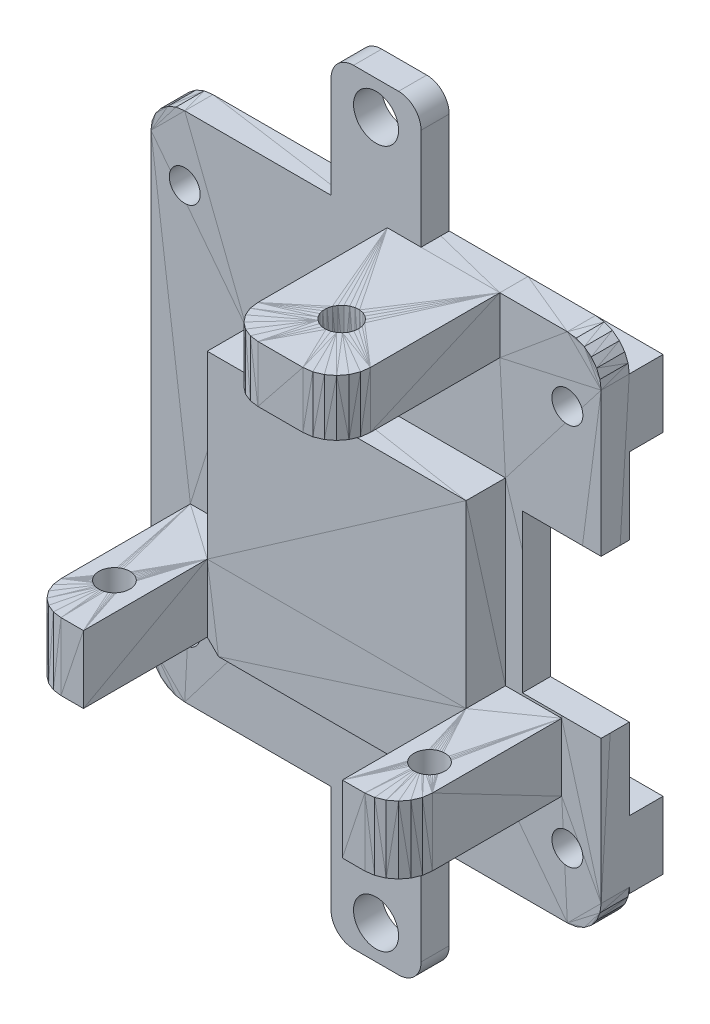
from build123d import *
from build123d.topology import SkipClean

# Parameters (mm, degrees)
CUT_EXTRUDE1_START       = 9.499999695
CUT_EXTRUDE1_DEPTH       = 22.000000812
CUT_EXTRUDE1_START_2     = 7.124999176
CUT_EXTRUDE1_2_OUTLINE_W = 39.999999106
CUT_EXTRUDE1_2_OUTLINE_H = 2.499999944
CUT_EXTRUDE1_2_DEPTH     = 31.2499998
CUT_EXTRUDE1_3_DEPTH     = 6.000000052
CUT_EXTRUDE1_START_3     = 40.500000119
CUT_EXTRUDE1_4_DEPTH     = 4.999998957
CUT_EXTRUDE1_START_4     = 41.124999176
CUT_EXTRUDE1_5_OUTLINE_W = 39.999999106
CUT_EXTRUDE1_5_OUTLINE_H = 2.499999944
CUT_EXTRUDE1_5_DEPTH     = 2.151459803
CUT_EXTRUDE1_START_5     = 2.223542891
CUT_EXTRUDE1_6_OUTLINE_W = 39.999999106
CUT_EXTRUDE1_6_OUTLINE_H = 2.499999944
CUT_EXTRUDE1_6_DEPTH     = 2.151456085
CUT_EXTRUDE1_7_DEPTH     = 2.499999944
CUT_EXTRUDE1_8_DEPTH     = 2.499999944
CUT_EXTRUDE1_START_6     = 2.499999944
CUT_EXTRUDE1_9_DEPTH     = 3.500000108
CUT_EXTRUDE2_REACH       = 64.923
SKETCH2_W                = 7
SKETCH2_H                = 14
SKETCH3_W                = 6
SKETCH3_H                = 6
BOSS_EXTRUDE1_DEPTH      = 3
CUT_EXTRUDE3_START       = -3
SKETCH4_R                = 1.375
CUT_EXTRUDE3_DEPTH       = 3
BOSS_EXTRUDE2_DEPTH      = 11.5
BOSS_EXTRUDE2_DEPTH_BACK = 56.5
SKETCH5_W                = 8
SKETCH5_H                = 2.499999944
CUT_EXTRUDE4_REACH       = 73.283
SKETCH6_R                = 2
FILLET1_R                = 2
SKETCH7_R                = 1.375
CUT_EXTRUDE5_DEPTH       = 10
SKETCH8_W                = 6
SKETCH8_H                = 1.5
CUT_EXTRUDE6_DEPTH       = 2


with BuildPart() as part:
    # Cut-Extrude1: read off the stored shape, not the designer's step
    # Cut-Extrude1 outline → Cut-Extrude1 (new body)
    with BuildSketch(Plane(origin=(0, 0, 0), x_dir=(1, 0, 0), z_dir=(0, 1, 0)).offset(CUT_EXTRUDE1_START)):
        Polygon((8.500000462, -2.499999944), (8.500000462, -6.000000052), (31.500000507, -6.000000052), (31.500000507, -2.499999944), (39.999999106, -2.499999944), (39.999999106, 0), (0, 0), (0, -2.499999944), align=None)
    extrude(amount=CUT_EXTRUDE1_DEPTH)

    # Cut-Extrude1 2 outline → Cut-Extrude1 2 (add)
    with BuildSketch(Plane(origin=(0, 0, 0), x_dir=(1, 0, 0), z_dir=(0, 1, 0)).offset(CUT_EXTRUDE1_START_2)):
        with Locations((19.999999553, -1.249999972)):
            Rectangle(CUT_EXTRUDE1_2_OUTLINE_W, CUT_EXTRUDE1_2_OUTLINE_H)
    extrude(amount=CUT_EXTRUDE1_2_DEPTH)

    # Cut-Extrude1 3 outline → Cut-Extrude1 3 (add)
    # profile 1 of 2: a face of its own
    with BuildSketch(Plane(origin=(0, 0, 0), x_dir=(1, 0, 0), z_dir=(0, 1, 0)).offset(CUT_EXTRUDE1_START)):
        Polygon((8.500000462, -2.499999944), (3.500000108, -2.499999944), (3.500000108, -14.000000432), (3.602222539, -14.776457101), (3.901924007, -15.499999747), (4.378679674, -16.121320426), (4.999999888, -16.598075628), (5.723542534, -16.897777095), (6.500000134, -17.000000924), (8.500000462, -17.000000924), align=None)
        Polygon((6.231762934, -12.463292107), (6.047092844, -12.498520315), (5.859463941, -12.48671487), (5.680665374, -12.428619899), (5.521932151, -12.327884324), (5.393237341, -12.190839276), (5.302667618, -12.0260939), (5.255914293, -11.843999848), (5.255914293, -11.656000279), (5.302667618, -11.473906226), (5.393237341, -11.309160851), (5.521932151, -11.172114871), (5.680665374, -11.071379296), (5.859463941, -11.013284326), (6.047092844, -11.001479812), (6.231762934, -11.03670802), (6.4018704, -11.116754264), (6.546726916, -11.236589402), (6.657229736, -11.388684623), (6.726437714, -11.563482694), (6.750000175, -11.749999598), (6.726437714, -11.936517432), (6.657229736, -12.111315504), (6.546726916, -12.263410725), (6.4018704, -12.383245863), align=None, mode=Mode.SUBTRACT)
    # profile 2 of 2: a face of its own
    with BuildSketch(Plane(origin=(0, 0, 0), x_dir=(1, 0, 0), z_dir=(0, 1, 0)).offset(CUT_EXTRUDE1_START)):
        Polygon((36.499999464, -2.499999944), (31.500000507, -2.499999944), (31.500000507, -17.000000924), (33.500000834, -17.000000924), (34.276459366, -16.897777095), (35.000000149, -16.598075628), (35.621318966, -16.121320426), (36.098074168, -15.499999747), (36.397777498, -14.776457101), (36.499999464, -14.000000432), align=None)
        Polygon((33.859461546, -12.48671487), (33.680662513, -12.428619899), (33.521931618, -12.327884324), (33.39323774, -12.190839276), (33.302668482, -12.0260939), (33.255912364, -11.843999848), (33.255912364, -11.656000279), (33.302668482, -11.473906226), (33.39323774, -11.309160851), (33.521931618, -11.172114871), (33.680662513, -11.071379296), (33.859461546, -11.013284326), (34.047093242, -11.001479812), (34.231763333, -11.03670802), (34.401871264, -11.116754264), (34.546725452, -11.236589402), (34.657228738, -11.388684623), (34.726437181, -11.563482694), (34.749999642, -11.749999598), (34.726437181, -11.936517432), (34.657228738, -12.111315504), (34.546725452, -12.263410725), (34.401871264, -12.383245863), (34.231763333, -12.463292107), (34.047093242, -12.498520315), align=None, mode=Mode.SUBTRACT)
    extrude(amount=CUT_EXTRUDE1_3_DEPTH)



with BuildPart() as body_2:
    # Cut-Extrude1 4 outline → Cut-Extrude1 4 (new body)
    with BuildSketch(Plane(origin=(0, 0, 0), x_dir=(1, 0, 0), z_dir=(0, 1, 0)).offset(CUT_EXTRUDE1_START_3)):
        Polygon((20.999999717, -2.499999944), (20.999999717, -14.000000432), (21.102221683, -14.776457101), (21.401925012, -15.499999747), (21.878678352, -16.121320426), (22.500000894, -16.598075628), (23.22354354, -16.897777095), (24.000000209, -17.000000924), (28.000000864, -17.000000924), (28.776457533, -16.897777095), (29.500000179, -16.598075628), (30.121320859, -16.121320426), (30.59807606, -15.499999747), (30.897777528, -14.776457101), (30.999999493, -14.000000432), (30.999999493, -2.499999944), align=None)
        Polygon((25.718927383, -13.023430482), (25.36133118, -12.90724054), (25.043863803, -12.70576939), (24.786474183, -12.431677431), (24.605335668, -12.102187611), (24.511827156, -11.737999506), (24.511827156, -11.362000369), (24.605335668, -10.997813195), (24.786474183, -10.668322444), (25.043863803, -10.394229554), (25.36133118, -10.192759335), (25.718927383, -10.076569393), (26.094185188, -10.052959435), (26.46352537, -10.123414919), (26.803739369, -10.283508338), (27.093453333, -10.523178615), (27.314459905, -10.827369988), (27.452874929, -11.176965199), (27.499999851, -11.549999937), (27.452874929, -11.923034675), (27.314459905, -12.272630818), (27.093453333, -12.576820329), (26.803739369, -12.816492468), (26.46352537, -12.976584025), (26.094185188, -13.04704044), align=None, mode=Mode.SUBTRACT)
    extrude(amount=CUT_EXTRUDE1_4_DEPTH)

    # Cut-Extrude1 5 outline → Cut-Extrude1 5 (add)
    with BuildSketch(Plane(origin=(0, 0, 0), x_dir=(1, 0, 0), z_dir=(0, 1, 0)).offset(CUT_EXTRUDE1_START_4)):
        with Locations((19.999999553, -1.249999972)):
            Rectangle(CUT_EXTRUDE1_5_OUTLINE_W, CUT_EXTRUDE1_5_OUTLINE_H)
    extrude(amount=CUT_EXTRUDE1_5_DEPTH)


with BuildPart() as body_3:
    # Cut-Extrude1 6 outline → Cut-Extrude1 6 (new body)
    with BuildSketch(Plane(origin=(0, 0, 0), x_dir=(1, 0, 0), z_dir=(0, 1, 0)).offset(CUT_EXTRUDE1_START_5)):
        with Locations((19.999999553, -1.249999972)):
            Rectangle(CUT_EXTRUDE1_6_OUTLINE_W, CUT_EXTRUDE1_6_OUTLINE_H)
    extrude(amount=CUT_EXTRUDE1_6_DEPTH)


with BuildPart() as cut_extrude1_7_tool:
    # Cut-Extrude1 7 outline → Cut-Extrude1 7 (new body)
    with BuildSketch(Plane.XY):
        Polygon((0, 42.500000447), (0.102222526, 43.276458979), (0, 43.276458979), align=None)
        Polygon((39.999999106, 43.276458979), (39.89777714, 43.276458979), (39.999999106, 42.500000447), align=None)
        Polygon((0.102222526, 2.223542891), (0, 3.000000026), (0, 2.223542891), align=None)
        Polygon((39.999999106, 2.223542891), (39.999999106, 3.000000026), (39.89777714, 2.223542891), align=None)
    extrude(amount=CUT_EXTRUDE1_7_DEPTH)


with BuildPart() as body_2_1:
    add(body_2.part)

    # Cut-Extrude1 7: cut by cut_extrude1_7_tool
    add(cut_extrude1_7_tool.part, mode=Mode.SUBTRACT)


with BuildPart() as body_3_1:
    add(body_3.part)

    # Cut-Extrude1 7: cut by cut_extrude1_7_tool
    add(cut_extrude1_7_tool.part, mode=Mode.SUBTRACT)


with BuildPart() as part_1:
    add(part.part)

    add(body_2_1.part)  # Cut-Extrude1 8 merges body 2

    add(body_3_1.part)  # Cut-Extrude1 8 merges body 3
    # Cut-Extrude1 8 outline → Cut-Extrude1 8 (add)
    with BuildSketch(Plane.XY):
        Polygon((1.500000013, 45.098077506), (0.878679624, 44.621318579), (0.401923782, 43.999999762), (0.102222526, 43.276458979), (39.89777714, 43.276458979), (39.598077536, 43.999999762), (39.121318609, 44.621318579), (38.499999791, 45.098077506), (37.776459008, 45.39777711), (37.000000477, 45.499999076), (3.000000026, 45.499999076), (2.223542891, 45.39777711), align=None)
        with BuildLine():
            Line((3.000000072, 41.124999076), (0, 41.124999176))
            Line((0, 41.124999176), (0, 38.374998976))
            Line((0, 38.374998976), (2.999999904, 38.374999076))
            ThreePointArc((2.999999904, 38.374999076), (1.625, 39.74999916), (3.000000072, 41.124999076))
        make_face()
        with BuildLine():
            Line((37, 41.124999076), (3.000000072, 41.124999076))
            ThreePointArc((3.000000072, 41.124999076), (4.375, 39.749998992), (2.999999904, 38.374999076))
            Line((2.999999904, 38.374999076), (37, 38.374999076))
            ThreePointArc((37, 38.374999076), (35.625, 39.749999076), (37, 41.124999076))
        make_face()
        with BuildLine():
            Line((39.999999106, 38.374998976), (39.999999106, 41.124999176))
            Line((39.999999106, 41.124999176), (37, 41.124999076))
            ThreePointArc((37, 41.124999076), (38.375, 39.749999076), (37, 38.374999076))
            Line((37, 38.374999076), (39.999999106, 38.374998976))
        make_face()
        with BuildLine():
            Line((3.000000032, 7.124999076), (0, 7.124999176))
            Line((0, 7.124999176), (0, 4.374998976))
            Line((0, 4.374998976), (2.999999968, 4.374999076))
            ThreePointArc((2.999999968, 4.374999076), (1.625, 5.749999108), (3.000000032, 7.124999076))
        make_face()
        with BuildLine():
            Line((37, 7.124999076), (3.000000032, 7.124999076))
            ThreePointArc((3.000000032, 7.124999076), (4.375, 5.749999044), (2.999999968, 4.374999076))
            Line((2.999999968, 4.374999076), (37, 4.374999076))
            ThreePointArc((37, 4.374999076), (35.625, 5.749999076), (37, 7.124999076))
        make_face()
        with BuildLine():
            Line((39.999999106, 4.374998976), (39.999999106, 7.124999176))
            Line((39.999999106, 7.124999176), (37, 7.124999076))
            ThreePointArc((37, 7.124999076), (38.375, 5.749999076), (37, 4.374999076))
            Line((37, 4.374999076), (39.999999106, 4.374998976))
        make_face()
        Polygon((39.89777714, 2.223542891), (0.102222526, 2.223542891), (0.401923782, 1.500000013), (0.878679624, 0.878679624), (1.500000013, 0.401923782), (2.223542891, 0.102222526), (3.000000026, 0), (37.000000477, 0), (37.776459008, 0.102222526), (38.499999791, 0.401923782), (39.121318609, 0.878679624), (39.598077536, 1.500000013), align=None)
    extrude(amount=CUT_EXTRUDE1_8_DEPTH)

    # Cut-Extrude1 9 outline → Cut-Extrude1 9 (add)
    with BuildSketch(Plane.XY.offset(CUT_EXTRUDE1_START_6)):
        Polygon((31.500000507, 9.499999695), (8.500000462, 9.499999695), (9.499999695, 8.500000462), (30.500000343, 8.500000462), align=None)
    extrude(amount=CUT_EXTRUDE1_9_DEPTH)

    # Cut-Extrude2: up to this face of the body (flat: up to its plane)
    cut_extrude2_end = Plane(part_1.part.faces().sort_by_distance((0.651754208, 2.690847606, 2.499999944))[0])
    # Sketch2 → Cut-Extrude2 (cut, up to the picked face)
    with BuildSketch(Plane(origin=(0, 0, 0), x_dir=(-1, 0, 0), z_dir=(0, 0, -1)), mode=Mode.PRIVATE) as cut_extrude2_sk1:
        with Locations((-36.499999106, 22.7092172)):
            Rectangle(SKETCH2_W, SKETCH2_H)
    cut_extrude2_tool1 = split(extrude(cut_extrude2_sk1.sketch, amount=-CUT_EXTRUDE2_REACH, mode=Mode.PRIVATE), bisect_by=cut_extrude2_end, keep=Keep.BOTH, mode=Mode.PRIVATE)
    add(cut_extrude2_tool1.solids().sort_by(Axis((36.499999, 22.709217, 0), (0, 0, 1)))[0], mode=Mode.SUBTRACT)

    # Sketch3 → Boss-Extrude1 (add)
    with BuildSketch(Plane(origin=(0, 0, 0), x_dir=(-1, 0, 0), z_dir=(0, 0, -1))):
        with Locations((-37, 39.500000447)):
            Rectangle(SKETCH3_W, SKETCH3_H)
        with Locations((-3, 39.500000447)):
            Rectangle(SKETCH3_W, SKETCH3_H)
        with Locations((-37, 5.500000447)):
            Rectangle(SKETCH3_W, SKETCH3_H)
        with Locations((-3, 5.500000447)):
            Rectangle(SKETCH3_W, SKETCH3_H)
    extrude(amount=BOSS_EXTRUDE1_DEPTH)

    # Sketch4 → Cut-Extrude3 (cut)
    with SkipClean():  # the faces are left unmerged after this step: merging them gives an invalid solid
        with BuildSketch(Plane.XY.offset(CUT_EXTRUDE3_START)):
            with Locations(Location((37, 5.749999076, 0), (0, 0, 105.709583928))):
                Circle(SKETCH4_R)
            with Locations(Location((3, 5.749999076, 0), (0, 0, 165.086240986))):
                Circle(SKETCH4_R)
            with Locations(Location((3, 39.749999076, 0), (0, 0, 157.929009931))):
                Circle(SKETCH4_R)
            with Locations(Location((37, 39.749999076, 0), (0, 0, 262.540518145))):
                Circle(SKETCH4_R)
        extrude(amount=CUT_EXTRUDE3_DEPTH, mode=Mode.SUBTRACT)

    # Sketch5 → Boss-Extrude2 (add, two sides: drawn at the far end of the back side and taken through both)
    with SkipClean():  # the faces are left unmerged after this step: merging them gives an invalid solid
        with BuildSketch(Plane(origin=(0, 0, 0), x_dir=(-1, 0, 0), z_dir=(0, -1, 0)).offset(-BOSS_EXTRUDE2_DEPTH_BACK)):
            with Locations((-20.000000251, -1.249999972)):
                Rectangle(SKETCH5_W, SKETCH5_H)
        extrude(amount=BOSS_EXTRUDE2_DEPTH + BOSS_EXTRUDE2_DEPTH_BACK)

    # Sketch6 → Cut-Extrude4 (cut, up to next)
    with BuildSketch(Plane(origin=(0, 0, 0), x_dir=(-1, 0, 0), z_dir=(0, 0, -1)), mode=Mode.PRIVATE) as cut_extrude4_sk1:
        with Locations((-20.000000251, 53.5)):
            Circle(SKETCH6_R)
    cut_extrude4_tool1 = extrude(cut_extrude4_sk1.sketch, amount=-CUT_EXTRUDE4_REACH, mode=Mode.PRIVATE) & part_1.part
    # Sketch6 → Cut-Extrude4 (cut, up to next)
    with BuildSketch(Plane(origin=(0, 0, 0), x_dir=(-1, 0, 0), z_dir=(0, 0, -1)), mode=Mode.PRIVATE) as cut_extrude4_sk2:
        with Locations((-20.000000251, -8.5)):
            Circle(SKETCH6_R)
    cut_extrude4_tool2 = extrude(cut_extrude4_sk2.sketch, amount=-CUT_EXTRUDE4_REACH, mode=Mode.PRIVATE) & part_1.part
    add(cut_extrude4_tool1.solids().sort_by_distance((20, 53.5, 0))[0], mode=Mode.SUBTRACT)
    add(cut_extrude4_tool2.solids().sort_by_distance((20, -8.5, 0))[0], mode=Mode.SUBTRACT)

    # Fillet1
    fillet1_edges = [part_1.edges().sort_by_distance(p)[0] for p in [
        (24.000000251, 56.5, 1.249999972),
        (16.000000251, 56.5, 1.249999972),
        (16.000000251, -11.5, 1.249999972),
        (24.000000251, -11.5, 1.249999972),
    ]]
    fillet(fillet1_edges, radius=FILLET1_R)

    # Sketch7 → Cut-Extrude5 (cut)
    with SkipClean():  # the faces are left unmerged after this step: merging them gives an invalid solid
        with BuildSketch(Plane(origin=(0, 9.499999695, 0), x_dir=(-1, 0, 0), z_dir=(0, -1, 0))):
            with Locations(Location((-6.000000462, -11.750000924, 0), (0, 0, 92.78870664))):
                Circle(SKETCH7_R)
            with Locations(Location((-34.000000507, -11.750000924, 0), (0, 0, 84.822384316))):
                Circle(SKETCH7_R)
        extrude(amount=-CUT_EXTRUDE5_DEPTH, mode=Mode.SUBTRACT)

    # Sketch8 → Cut-Extrude6 (cut)
    with SkipClean():  # the faces are left unmerged after this step: merging them gives an invalid solid
        with BuildSketch(Plane(origin=(0, 0, -3), x_dir=(-1, 0, 0), z_dir=(0, 0, -1))):
            with Locations((-3, 37.250000447)):
                Rectangle(SKETCH8_W, SKETCH8_H)
        extrude(amount=-CUT_EXTRUDE6_DEPTH, mode=Mode.SUBTRACT)


solid = part_1.part
